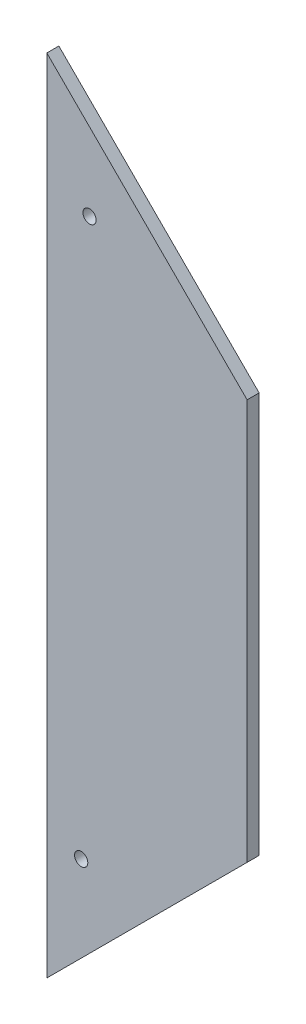
from build123d import *

# Parameters (mm, degrees)
EXTRUDE_1_DEPTH     = 3
SKETCH_5_R          = 1.65
CUT_EXTRUDE_1_DEPTH = 8


with BuildPart() as part:
    # Эскиз1 → Бобышка-Вытянуть1 (new body)
    with BuildSketch(Plane.XY):
        Polygon((0, 0), (0, 200), (50, 150), (50, 50), align=None)
    extrude(amount=EXTRUDE_1_DEPTH)

    # Эскиз5 → Вырез-Вытянуть1 (cut)
    with BuildSketch(Plane(origin=(-305.961161651, -184.204468703, -1.5), x_dir=(-0.9998892265297747, 0.014884040771535543, 0), z_dir=(0, 0, -1))):
        with Locations((-311.309295343, 358.877763083)):
            Circle(SKETCH_5_R)
        with Locations((-311.309295343, 218.877763083)):
            Circle(SKETCH_5_R)
    extrude(amount=-CUT_EXTRUDE_1_DEPTH, mode=Mode.SUBTRACT)


solid = part.part
